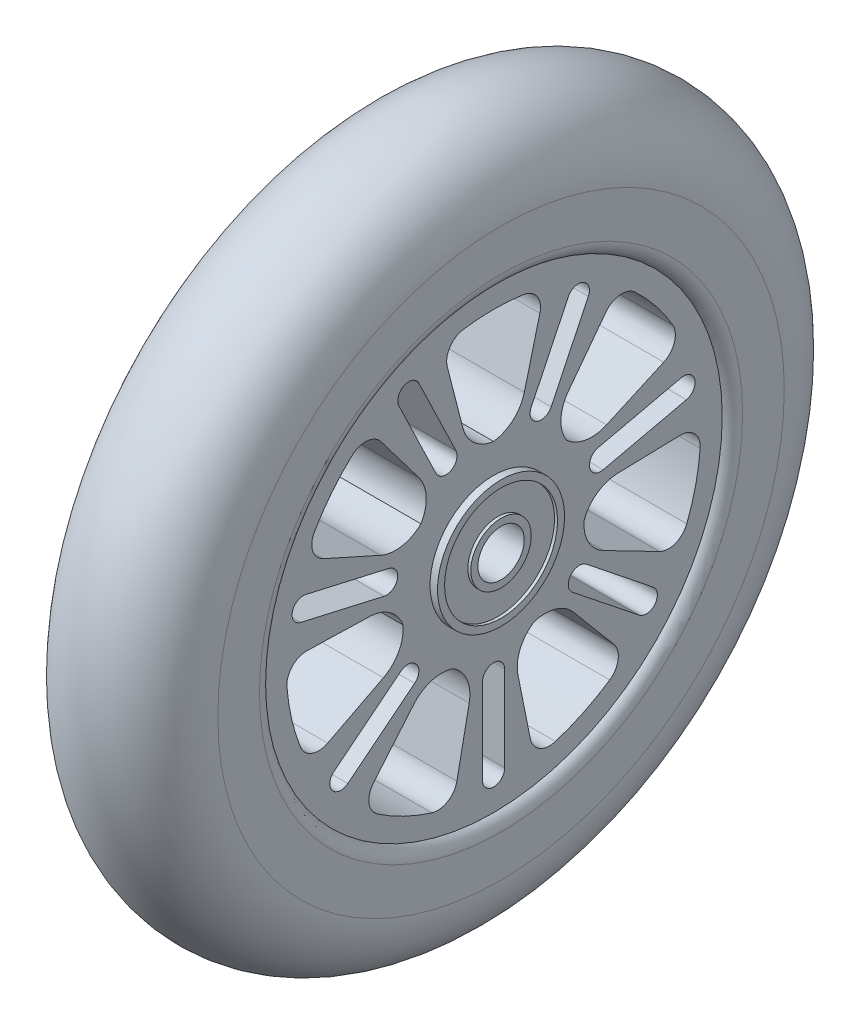
from build123d import *

# Parameters (mm, degrees)
SKETCH2_R          = 3.937
CUT_EXTRUDE1_DEPTH = 89.486469768
CUT_EXTRUDE2_DEPTH = 89.486469768
SKETCH5_R          = 38.857978685
SKETCH5_R_2        = 10.795
CUT_EXTRUDE3_DEPTH = 1.27
SKETCH6_R          = 9.598574497
SKETCH6_R_2        = 5.136074626
CUT_EXTRUDE4_DEPTH = 0.508
FILLET3_R          = 2.54


with BuildPart() as part:
    # Sketch1 → Revolve1 (revolve)
    with BuildSketch(Plane(origin=(0, 0, 0), x_dir=(1, 0, 0), z_dir=(0, 1, 0))):
        with BuildLine():
            Line((0, 0), (-24.13, 0))
            Line((-24.13, 0), (-24.13, 48.133))
            ThreePointArc((-24.13, 48.133), (-12.065, 60.198), (0, 48.133))
            Line((0, 48.133), (0, 0))
        make_face()
    revolve(axis=Axis((0, 0, 0), (-1, 0, 0)))

    # Sketch2 → Cut-Extrude1 (cut, through all)
    with BuildSketch(Plane(origin=(0, 0, 0), x_dir=(0, 0, -1), z_dir=(1, 0, 0))):
        Circle(SKETCH2_R)
    extrude(amount=-CUT_EXTRUDE1_DEPTH, mode=Mode.SUBTRACT)

    # Sketch3 → Cut-Extrude2 (cut, through all)
    with BuildSketch(Plane(origin=(0, 0, 0), x_dir=(0, 0, -1), z_dir=(1, 0, 0))):
        with BuildLine():
            ThreePointArc((-7.868701987, 30.719014265), (-7.414350559, 33.395529437), (-5.121198299, 34.848671341))
            ThreePointArc((-5.121198299, 34.848671341), (0, 35.222955104), (5.121198299, 34.848671341))
            ThreePointArc((5.121198299, 34.848671341), (7.414350559, 33.395529437), (7.868701987, 30.719014265))
            Line((7.868701987, 30.719014265), (5.226080148, 20.402352367))
            ThreePointArc((5.226080148, 20.402352367), (3.322663277, 17.290224183), (0, 15.784154342))
            ThreePointArc((0, 15.784154342), (-3.322663277, 17.290224183), (-5.226080148, 20.402352367))
            Line((-5.226080148, 20.402352367), (-7.868701987, 30.719014265))
        make_face()
        with BuildLine():
            Line((-16.098624321, 29.076332472), (-9.794359632, 15.986465761))
            ThreePointArc((-9.794359632, 15.986465761), (-7.273828196, 15.104584389), (-6.391946824, 17.625115825))
            Line((-6.391946824, 17.625115825), (-12.696211514, 30.714982536))
            ThreePointArc((-12.696211514, 30.714982536), (-15.216742949, 31.596863908), (-16.098624321, 29.076332472))
        make_face()
        with BuildLine():
            ThreePointArc((-12.340172279, 9.840477432), (-15.589311763, 8.181733863), (-19.209232563, 8.633962814))
            Line((-19.209232563, 8.633962814), (-28.922771395, 13.000211347))
            ThreePointArc((-28.922771395, 13.000211347), (-30.732071739, 15.024217511), (-30.438426779, 17.7230953))
            ThreePointArc((-30.438426779, 17.7230953), (-27.538038696, 21.960371467), (-24.052396954, 25.730923416))
            ThreePointArc((-24.052396954, 25.730923416), (-21.486527816, 26.61776289), (-19.11066051, 25.304209225))
            Line((-19.11066051, 25.304209225), (-12.692417211, 16.805790793))
            ThreePointArc((-12.692417211, 16.805790793), (-11.446018427, 13.377259374), (-12.340172279, 9.840477432))
        make_face()
        with BuildLine():
            Line((-32.7697437, 5.541603622), (-18.605029061, 2.309077827))
            ThreePointArc((-18.605029061, 2.309077827), (-16.344020796, 3.729864614), (-17.764807583, 5.99087288))
            Line((-17.764807583, 5.99087288), (-31.929522221, 9.223398675))
            ThreePointArc((-31.929522221, 9.223398675), (-34.190530487, 7.802611888), (-32.7697437, 5.541603622))
        make_face()
        with BuildLine():
            ThreePointArc((-15.387190118, -3.513279694), (-16.116137508, -7.087768933), (-18.726688041, -9.635976839))
            Line((-18.726688041, -9.635976839), (-28.196651006, -14.508015872))
            ThreePointArc((-28.196651006, -14.508015872), (-30.907163058, -14.660636639), (-32.834146044, -12.748332988))
            ThreePointArc((-32.834146044, -12.748332988), (-34.33861956, -7.838819794), (-35.113293701, -2.762734656))
            ThreePointArc((-35.113293701, -2.762734656), (-34.20685948, -0.203722017), (-31.698552836, 0.834818527))
            Line((-31.698552836, 0.834818527), (-21.052512511, 0.554125976))
            ThreePointArc((-21.052512511, 0.554125976), (-17.594861779, -0.60905459), (-15.387190118, -3.513279694))
        make_face()
        with BuildLine():
            Line((-24.763824671, -22.166065784), (-13.404979114, -13.107092807))
            ThreePointArc((-13.404979114, -13.107092807), (-13.106079358, -10.45351929), (-15.759652875, -10.154619535))
            Line((-15.759652875, -10.154619535), (-27.118498432, -19.213592512))
            ThreePointArc((-27.118498432, -19.213592512), (-27.417398188, -21.867166029), (-24.763824671, -22.166065784))
        make_face()
        with BuildLine():
            ThreePointArc((-6.846586936, -14.221465552), (-4.506429979, -17.020037158), (-4.141812449, -20.649829394))
            Line((-4.141812449, -20.649829394), (-6.237124282, -31.091411229))
            ThreePointArc((-6.237124282, -31.091411229), (-7.807777183, -33.305732377), (-10.504330622, -33.620006517))
            ThreePointArc((-10.504330622, -33.620006517), (-15.280766495, -31.735219868), (-19.73241109, -29.175997183))
            ThreePointArc((-19.73241109, -29.175997183), (-21.167975243, -26.87180009), (-20.416035323, -24.263207549))
            Line((-20.416035323, -24.263207549), (-13.558883477, -16.114807003))
            ThreePointArc((-13.558883477, -16.114807003), (-10.493662321, -14.136738026), (-6.846586936, -14.221465552))
        make_face()
        with BuildLine():
            Line((1.890512446, -33.182235549), (1.890046539, -18.653355221))
            ThreePointArc((1.890046539, -18.653355221), (0.001760172, -16.765189956), (-1.886405093, -18.653476323))
            Line((-1.886405093, -18.653476323), (-1.885939187, -33.182356651))
            ThreePointArc((-1.885939187, -33.182356651), (0.00234718, -35.070521916), (1.890512446, -33.182235549))
        make_face()
        with BuildLine():
            ThreePointArc((6.850388874, -14.220597785), (10.497464259, -14.135870258), (13.562685415, -16.113939236))
            Line((13.562685415, -16.113939236), (20.419837261, -24.262339782))
            ThreePointArc((20.419837261, -24.262339782), (21.171777181, -26.870932322), (19.736213028, -29.175129416))
            ThreePointArc((19.736213028, -29.175129416), (15.284568432, -31.734352101), (10.50813256, -33.619138749))
            ThreePointArc((10.50813256, -33.619138749), (7.811579121, -33.30486461), (6.240926219, -31.090543462))
            Line((6.240926219, -31.090543462), (4.145614387, -20.648961626))
            ThreePointArc((4.145614387, -20.648961626), (4.510231917, -17.019169391), (6.850388874, -14.220597785))
        make_face()
        with BuildLine():
            Line((27.122008151, -19.211505151), (15.762581618, -10.153260695))
            ThreePointArc((15.762581618, -10.153260695), (13.109027277, -10.452330638), (13.408097219, -13.105884979))
            Line((13.408097219, -13.105884979), (24.767523753, -22.164129435))
            ThreePointArc((24.767523753, -22.164129435), (27.421078094, -21.865059493), (27.122008151, -19.211505151))
        make_face()
        with BuildLine():
            ThreePointArc((15.389635159, -3.511329838), (17.597306821, -0.607104734), (21.054957553, 0.556075831))
            Line((21.054957553, 0.556075831), (31.700997878, 0.836768383))
            ThreePointArc((31.700997878, 0.836768383), (34.209304522, -0.201772161), (35.115738743, -2.7607848))
            ThreePointArc((35.115738743, -2.7607848), (34.341064602, -7.836869939), (32.836591086, -12.746383132))
            ThreePointArc((32.836591086, -12.746383132), (30.9096081, -14.658686784), (28.199096048, -14.506066016))
            Line((28.199096048, -14.506066016), (18.729133083, -9.634026983))
            ThreePointArc((18.729133083, -9.634026983), (16.11858255, -7.085819077), (15.389635159, -3.511329838))
        make_face()
        with BuildLine():
            Line((31.930831552, 9.225880469), (17.766324261, 5.992446224))
            ThreePointArc((17.766324261, 5.992446224), (16.345682487, 3.73134684), (18.606781871, 2.310705066))
            Line((18.606781871, 2.310705066), (32.771289161, 5.544139311))
            ThreePointArc((32.771289161, 5.544139311), (34.191930935, 7.805238695), (31.930831552, 9.225880469))
        make_face()
        with BuildLine():
            ThreePointArc((12.340925299, 9.842041095), (11.446771448, 13.378823037), (12.693170232, 16.807354456))
            Line((12.693170232, 16.807354456), (19.111413531, 25.305772888))
            ThreePointArc((19.111413531, 25.305772888), (21.487280836, 26.619326553), (24.053149974, 25.732487079))
            ThreePointArc((24.053149974, 25.732487079), (27.538791716, 21.96193513), (30.4391798, 17.724658963))
            ThreePointArc((30.4391798, 17.724658963), (30.732824759, 15.025781174), (28.923524416, 13.00177501))
            Line((28.923524416, 13.00177501), (19.209985583, 8.635526477))
            ThreePointArc((19.209985583, 8.635526477), (15.590064784, 8.183297526), (12.340925299, 9.842041095))
        make_face()
        with BuildLine():
            Line((12.695840543, 30.715989922), (6.392415389, 17.625718912))
            ThreePointArc((6.392415389, 17.625718912), (7.274458414, 15.105244041), (9.794933285, 15.987287066))
            Line((9.794933285, 15.987287066), (16.098358439, 29.077558076))
            ThreePointArc((16.098358439, 29.077558076), (15.216315414, 31.598032947), (12.695840543, 30.715989922))
        make_face()
    extrude(amount=-CUT_EXTRUDE2_DEPTH, mode=Mode.SUBTRACT)

    # Sketch5 → Cut-Extrude3 (cut)
    with BuildSketch(Plane(origin=(0, 0, 0), x_dir=(0, 0, -1), z_dir=(1, 0, 0))):
        Circle(SKETCH5_R)
        Circle(SKETCH5_R_2, mode=Mode.SUBTRACT)
    cut_extrude3 = extrude(amount=-CUT_EXTRUDE3_DEPTH, mode=Mode.SUBTRACT)

    # Sketch6 → Cut-Extrude4 (cut)
    with BuildSketch(Plane.ZY.offset(24.13)):
        Circle(SKETCH6_R)
        Circle(SKETCH6_R_2, mode=Mode.SUBTRACT)
    cut_extrude4 = extrude(amount=-CUT_EXTRUDE4_DEPTH, mode=Mode.SUBTRACT)

    # Mirror8: Cut-Extrude3 across plane
    add(cut_extrude3.mirror(Plane(origin=(-12.065, 0, 0), x_dir=(0, 0, 1), z_dir=(1, 0, 0))), mode=Mode.SUBTRACT)

    # Mirror11: Cut-Extrude4 across plane
    add(cut_extrude4.mirror(Plane(origin=(-12.065, 0, 0), x_dir=(0, 0, 1), z_dir=(1, 0, 0))), mode=Mode.SUBTRACT)

    # Fillet3
    # the kernel refuses this fillet: 2.54 mm, written as the material it takes off along each edge
    with BuildSketch(Plane(origin=(0, 0, 0), x_dir=(0, 0, -1), z_dir=(0, -1, 0))) as fillet3_piece_1:
        with BuildLine():
            CenterArc((41.05768321, -2.54), FILLET3_R, 90, 60)
            Line((38.857978685, -1.27), (38.813984594, -1.2446))
            ThreePointArc((38.813984594, -1.2446), (38.807178685, -0.635), (38.807178685, 0))
            Line((38.807178685, 0), (38.857978685, 0.0508))
            Line((38.857978685, 0.0508), (41.05768321, 0.0508))
            Line((41.05768321, 0.0508), (41.05768321, 0))
        make_face()
    revolve(axis=Axis((0, 0, 0), (1, 0, 0)), mode=Mode.SUBTRACT)
    with BuildSketch(Plane(origin=(-24.13, 0, 0), x_dir=(0, 0, -1), z_dir=(0, -1, 0))) as fillet3_piece_2:
        with BuildLine():
            CenterArc((41.05768321, 2.54), FILLET3_R, 210, 60)
            Line((38.857978685, 1.27), (38.813984594, 1.2446))
            ThreePointArc((38.813984594, 1.2446), (38.807178685, 0.635), (38.807178685, 0))
            Line((38.807178685, 0), (38.857978685, -0.0508))
            Line((38.857978685, -0.0508), (41.05768321, -0.0508))
            Line((41.05768321, -0.0508), (41.05768321, 0))
        make_face()
    revolve(axis=Axis((-24.13, 0, 0), (1, 0, 0)), mode=Mode.SUBTRACT)


solid = part.part
